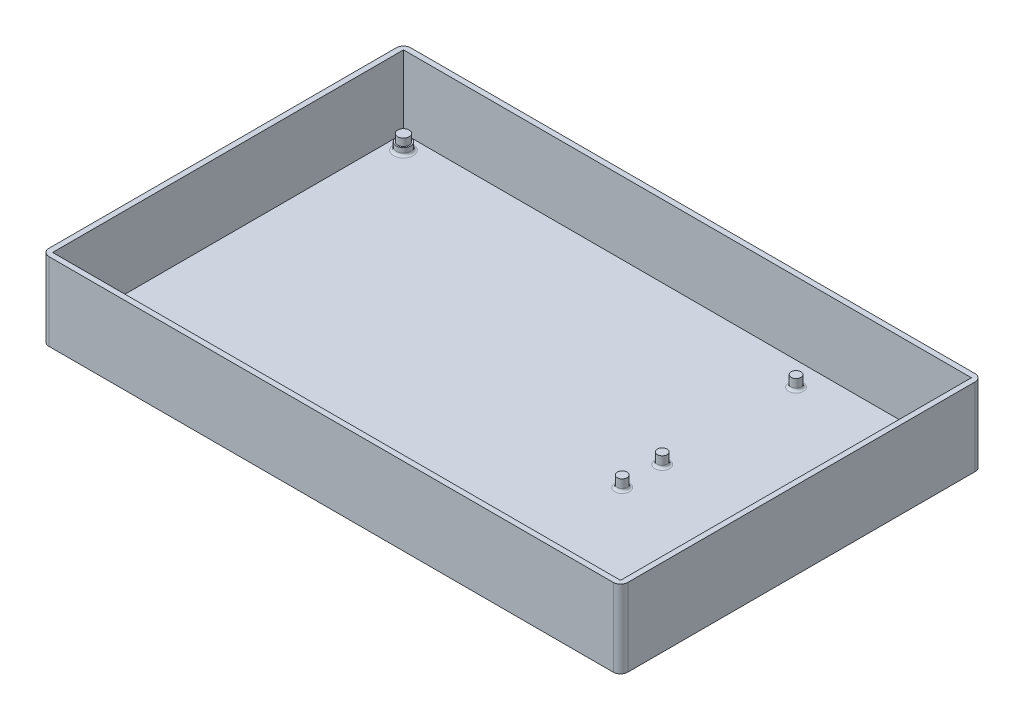
from build123d import *

# Parameters (mm, degrees)
SKETCH1_W           = 160
SKETCH1_H           = 100
SKETCH1_W_2         = 157
SKETCH1_H_2         = 97
BOSS_EXTRUDE1_DEPTH = 20
SKETCH2_W           = 160
SKETCH2_H           = 100
BOSS_EXTRUDE2_DEPTH = 1.5
SKETCH3_R           = 2
BOSS_EXTRUDE3_DEPTH = 2
SKETCH4_R           = 1.6
BOSS_EXTRUDE4_DEPTH = 2
SKETCH5_R           = 1.35
BOSS_EXTRUDE5_DEPTH = 3
FILLET1_R           = 0.7
FILLET2_R           = 2


with BuildPart() as part:
    # Sketch1 → Boss-Extrude1 (new body)
    with BuildSketch(Plane(origin=(0, 0, 0), x_dir=(1, 0, 0), z_dir=(0, 1, 0))):
        with Locations((80, 50)):
            Rectangle(SKETCH1_W, SKETCH1_H)
        with Locations((80, 50)):
            Rectangle(SKETCH1_W_2, SKETCH1_H_2, mode=Mode.SUBTRACT)
    extrude(amount=BOSS_EXTRUDE1_DEPTH)

    # Sketch2 → Boss-Extrude2 (add)
    with BuildSketch(Plane.XZ):
        with Locations((80, -50)):
            Rectangle(SKETCH2_W, SKETCH2_H)
    extrude(amount=BOSS_EXTRUDE2_DEPTH)

    # Sketch3 → Boss-Extrude3 (add)
    with BuildSketch(Plane(origin=(0, 0, 0), x_dir=(1, 0, 0), z_dir=(0, 1, 0))):
        with Locations((5.5, 5.5)):
            Circle(SKETCH3_R)
        with Locations((5.5, 94.5)):
            Circle(SKETCH3_R)
        with Locations((94.5, 5.5)):
            Circle(SKETCH3_R)
    extrude(amount=BOSS_EXTRUDE3_DEPTH)

    # Sketch4 → Boss-Extrude4 (add)
    with BuildSketch(Plane(origin=(0, 2, 0), x_dir=(1, 0, 0), z_dir=(0, 1, 0))):
        with Locations((5.5, 5.5)):
            Circle(SKETCH4_R)
        with Locations((94.5, 5.5)):
            Circle(SKETCH4_R)
        with Locations((5.5, 94.5)):
            Circle(SKETCH4_R)
    extrude(amount=BOSS_EXTRUDE4_DEPTH)

    # Sketch5 → Boss-Extrude5 (add)
    with BuildSketch(Plane(origin=(0, 0, 0), x_dir=(1, 0, 0), z_dir=(0, 1, 0))):
        with Locations((116.5, 92.027397936)):
            Circle(SKETCH5_R)
        with Locations((116.5, 55.027397936)):
            Circle(SKETCH5_R)
        with Locations((153.5, 55.027397936)):
            Circle(SKETCH5_R)
        with Locations((153.5, 92.027397936)):
            Circle(SKETCH5_R)
        with Locations((116.5, 43.968882069)):
            Circle(SKETCH5_R)
        with Locations((153.5, 43.968882069)):
            Circle(SKETCH5_R)
        with Locations((116.5, 6.968882069)):
            Circle(SKETCH5_R)
        with Locations((153.5, 6.968882069)):
            Circle(SKETCH5_R)
    extrude(amount=BOSS_EXTRUDE5_DEPTH)

    # Fillet1
    fillet1_edges = [part.edges().sort_by_distance(p)[0] for p in [
        (152.15, 0, -6.968882069),
        (92.5, 0, -5.5),
        (115.15, 0, -6.968882069),
        (3.5, 0, -5.5),
        (3.5, 0, -94.5),
        (152.15, 0, -43.968882069),
        (115.15, 0, -43.968882069),
        (115.15, 0, -55.027397936),
        (152.15, 0, -55.027397936),
        (152.15, 0, -92.027397936),
        (115.15, 0, -92.027397936),
    ]]
    fillet(fillet1_edges, radius=FILLET1_R)

    # Fillet2
    fillet2_edges = [part.edges().sort_by_distance(p)[0] for p in [
        (160, 9.25, -100),
        (0, 9.25, -100),
        (0, 9.25, 0),
        (160, 9.25, 0),
    ]]
    fillet(fillet2_edges, radius=FILLET2_R)


solid = part.part
